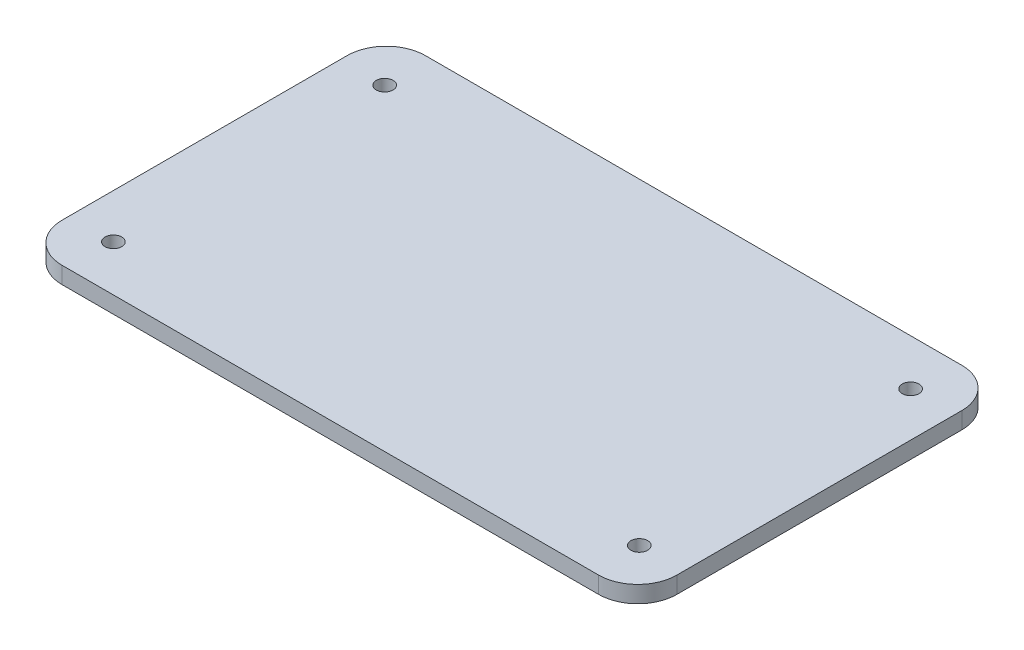
from build123d import *

# Parameters (mm, degrees)
SKETCH1_R           = 1.5
BOSS_EXTRUDE1_DEPTH = 1.5


with BuildPart() as part:
    # Sketch1 → Boss-Extrude1 (new, symmetric)
    with BuildSketch(Plane(origin=(0, 0, 0), x_dir=(1, 0, 0), z_dir=(0, 1, 0))):
        with BuildLine():
            Line((48, -32.5), (-48, -32.5))
            ThreePointArc((-48, -32.5), (-52.949747468, -30.449747468), (-55, -25.5))
            Line((-55, -25.5), (-55, 25.5))
            ThreePointArc((-55, 25.5), (-52.949747468, 30.449747468), (-48, 32.5))
            Line((-48, 32.5), (48, 32.5))
            ThreePointArc((48, 32.5), (52.949747468, 30.449747468), (55, 25.5))
            Line((55, 25.5), (55, -25.5))
            ThreePointArc((55, -25.5), (52.949747468, -30.449747468), (48, -32.5))
        make_face()
        with Locations((-47.05, 24.27)):
            Circle(SKETCH1_R, mode=Mode.SUBTRACT)
        with Locations((-47.05, -24.27)):
            Circle(SKETCH1_R, mode=Mode.SUBTRACT)
        with Locations((47.05, -24.27)):
            Circle(SKETCH1_R, mode=Mode.SUBTRACT)
        with Locations((47.05, 24.27)):
            Circle(SKETCH1_R, mode=Mode.SUBTRACT)
    extrude(amount=BOSS_EXTRUDE1_DEPTH, both=True)


solid = part.part
